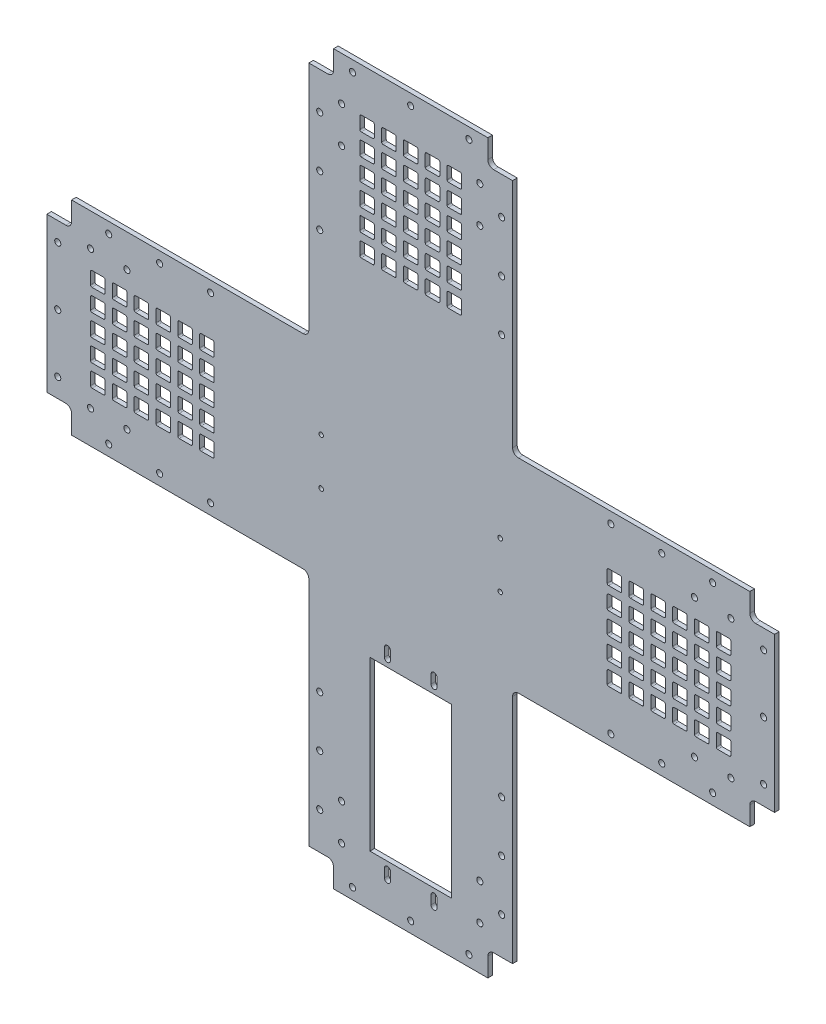
from build123d import *

# Parameters (mm, degrees)
SKETCH1_R              = 2.1
SKETCH1_W              = 56
SKETCH1_H              = 115.35
SKETCH1_R_2            = 1.55
BOSS_EXTRUDE1_DEPTH    = 3.175
FILLET1_R              = 4
SKETCH2_W              = 10
SKETCH2_H              = 10
CUT_EXTRUDE1_DEPTH     = 10
FILLET2_R              = 1
LPATTERN2_COUNT        = 5
LPATTERN2_PITCH        = 15
LPATTERN2_COUNT_DIR2   = 6
LPATTERN2_PITCH_DIR2   = 15
FILLET2_OF_LPATTERN2_R = 1
SKETCH6_W              = 10
SKETCH6_H              = 10
CUT_EXTRUDE2_DEPTH     = 10
FILLET3_R              = 1
LPATTERN5_COUNT        = 5
LPATTERN5_PITCH        = 15
LPATTERN5_COUNT_DIR2   = 6
LPATTERN5_PITCH_DIR2   = 15
FILLET3_OF_LPATTERN5_R = 1
SKETCH9_W              = 10
SKETCH9_H              = 10
CUT_EXTRUDE10_DEPTH    = 5
FILLET4_R              = 1
LPATTERN6_COUNT        = 5
LPATTERN6_PITCH        = 15
LPATTERN6_COUNT_DIR2   = 6
LPATTERN6_PITCH_DIR2   = 15
FILLET4_OF_LPATTERN6_R = 1


with BuildPart() as part:
    # Sketch1 → Boss-Extrude1 (new body)
    with BuildSketch(Plane.XY):
        Polygon((0, 163), (0, 0), (-163, 0), (-163, -17), (-180, -17), (-180, -123), (-163, -123), (-163, -140), (0, -140), (0, -303), (17, -303), (17, -320), (123, -320), (123, -303), (140, -303), (140, -140), (303, -140), (303, -123), (320, -123), (320, -17), (303, -17), (303, 0), (140, 0), (140, 163), (123, 163), (123, 180), (17, 180), (17, 163), align=None)
        with Locations((7.5, -277.5)):
            Circle(SKETCH1_R, mode=Mode.SUBTRACT)
        with Locations((30, -312.5)):
            Circle(SKETCH1_R, mode=Mode.SUBTRACT)
        with Locations((22.5, -290)):
            Circle(SKETCH1_R, mode=Mode.SUBTRACT)
        with Locations((70, -312.5)):
            Circle(SKETCH1_R, mode=Mode.SUBTRACT)
        with BuildLine():
            Line((51.95, -296), (51.95, -290))
            ThreePointArc((51.95, -290), (54, -287.95), (56.05, -290))
            Line((56.05, -290), (56.05, -296))
            ThreePointArc((56.05, -296), (54, -298.05), (51.95, -296))
        make_face(mode=Mode.SUBTRACT)
        with Locations((22.5, -265)):
            Circle(SKETCH1_R, mode=Mode.SUBTRACT)
        with Locations((7.5, -242.5)):
            Circle(SKETCH1_R, mode=Mode.SUBTRACT)
        with Locations((7.5, -207.5)):
            Circle(SKETCH1_R, mode=Mode.SUBTRACT)
        with Locations((70, -227.325)):
            Rectangle(SKETCH1_W, SKETCH1_H, mode=Mode.SUBTRACT)
        with Locations((-150, -117.5)):
            Circle(SKETCH1_R, mode=Mode.SUBTRACT)
        with Locations((-172.5, -110)):
            Circle(SKETCH1_R, mode=Mode.SUBTRACT)
        with Locations((-137.5, -132.5)):
            Circle(SKETCH1_R, mode=Mode.SUBTRACT)
        with Locations((-125, -117.5)):
            Circle(SKETCH1_R, mode=Mode.SUBTRACT)
        with Locations((-102.5, -132.5)):
            Circle(SKETCH1_R, mode=Mode.SUBTRACT)
        with Locations((-67.5, -132.5)):
            Circle(SKETCH1_R, mode=Mode.SUBTRACT)
        with BuildLine():
            ThreePointArc((56.05, -164.65), (54, -166.7), (51.95, -164.65))
            Line((51.95, -164.65), (51.95, -158.65))
            ThreePointArc((51.95, -158.65), (54, -156.6), (56.05, -158.65))
            Line((56.05, -158.65), (56.05, -164.65))
        make_face(mode=Mode.SUBTRACT)
        with Locations((8.5, -86)):
            Circle(SKETCH1_R_2, mode=Mode.SUBTRACT)
        with BuildLine():
            ThreePointArc((83.95, -290), (86, -287.95), (88.05, -290))
            Line((88.05, -290), (88.05, -296))
            ThreePointArc((88.05, -296), (86, -298.05), (83.95, -296))
            Line((83.95, -296), (83.95, -290))
        make_face(mode=Mode.SUBTRACT)
        with Locations((110, -312.5)):
            Circle(SKETCH1_R, mode=Mode.SUBTRACT)
        with Locations((117.5, -290)):
            Circle(SKETCH1_R, mode=Mode.SUBTRACT)
        with Locations((132.5, -277.5)):
            Circle(SKETCH1_R, mode=Mode.SUBTRACT)
        with Locations((117.5, -265)):
            Circle(SKETCH1_R, mode=Mode.SUBTRACT)
        with Locations((132.5, -242.5)):
            Circle(SKETCH1_R, mode=Mode.SUBTRACT)
        with Locations((132.5, -207.5)):
            Circle(SKETCH1_R, mode=Mode.SUBTRACT)
        with BuildLine():
            Line((88.05, -158.65), (88.05, -164.65))
            ThreePointArc((88.05, -164.65), (86, -166.7), (83.95, -164.65))
            Line((83.95, -164.65), (83.95, -158.65))
            ThreePointArc((83.95, -158.65), (86, -156.6), (88.05, -158.65))
        make_face(mode=Mode.SUBTRACT)
        with Locations((131.5, -86)):
            Circle(SKETCH1_R_2, mode=Mode.SUBTRACT)
        with Locations((207.5, -132.5)):
            Circle(SKETCH1_R, mode=Mode.SUBTRACT)
        with Locations((242.5, -132.5)):
            Circle(SKETCH1_R, mode=Mode.SUBTRACT)
        with Locations((277.5, -132.5)):
            Circle(SKETCH1_R, mode=Mode.SUBTRACT)
        with Locations((265, -117.5)):
            Circle(SKETCH1_R, mode=Mode.SUBTRACT)
        with Locations((290, -117.5)):
            Circle(SKETCH1_R, mode=Mode.SUBTRACT)
        with Locations((312.5, -110)):
            Circle(SKETCH1_R, mode=Mode.SUBTRACT)
        with Locations((312.5, -70)):
            Circle(SKETCH1_R, mode=Mode.SUBTRACT)
        with Locations((-172.5, -70)):
            Circle(SKETCH1_R, mode=Mode.SUBTRACT)
        with Locations((-172.5, -30)):
            Circle(SKETCH1_R, mode=Mode.SUBTRACT)
        with Locations((-150, -22.5)):
            Circle(SKETCH1_R, mode=Mode.SUBTRACT)
        with Locations((-125, -22.5)):
            Circle(SKETCH1_R, mode=Mode.SUBTRACT)
        with Locations((-137.5, -7.5)):
            Circle(SKETCH1_R, mode=Mode.SUBTRACT)
        with Locations((-102.5, -7.5)):
            Circle(SKETCH1_R, mode=Mode.SUBTRACT)
        with Locations((-67.5, -7.5)):
            Circle(SKETCH1_R, mode=Mode.SUBTRACT)
        with Locations((8.5, -54)):
            Circle(SKETCH1_R_2, mode=Mode.SUBTRACT)
        with Locations((7.5, 67.5)):
            Circle(SKETCH1_R, mode=Mode.SUBTRACT)
        with Locations((7.5, 102.5)):
            Circle(SKETCH1_R, mode=Mode.SUBTRACT)
        with Locations((7.5, 137.5)):
            Circle(SKETCH1_R, mode=Mode.SUBTRACT)
        with Locations((22.5, 125)):
            Circle(SKETCH1_R, mode=Mode.SUBTRACT)
        with Locations((22.5, 150)):
            Circle(SKETCH1_R, mode=Mode.SUBTRACT)
        with Locations((30, 172.5)):
            Circle(SKETCH1_R, mode=Mode.SUBTRACT)
        with Locations((70, 172.5)):
            Circle(SKETCH1_R, mode=Mode.SUBTRACT)
        with Locations((131.5, -54)):
            Circle(SKETCH1_R_2, mode=Mode.SUBTRACT)
        with Locations((207.5, -7.5)):
            Circle(SKETCH1_R, mode=Mode.SUBTRACT)
        with Locations((242.5, -7.5)):
            Circle(SKETCH1_R, mode=Mode.SUBTRACT)
        with Locations((265, -22.5)):
            Circle(SKETCH1_R, mode=Mode.SUBTRACT)
        with Locations((277.5, -7.5)):
            Circle(SKETCH1_R, mode=Mode.SUBTRACT)
        with Locations((312.5, -30)):
            Circle(SKETCH1_R, mode=Mode.SUBTRACT)
        with Locations((290, -22.5)):
            Circle(SKETCH1_R, mode=Mode.SUBTRACT)
        with Locations((132.5, 67.5)):
            Circle(SKETCH1_R, mode=Mode.SUBTRACT)
        with Locations((132.5, 102.5)):
            Circle(SKETCH1_R, mode=Mode.SUBTRACT)
        with Locations((117.5, 125)):
            Circle(SKETCH1_R, mode=Mode.SUBTRACT)
        with Locations((132.5, 137.5)):
            Circle(SKETCH1_R, mode=Mode.SUBTRACT)
        with Locations((117.5, 150)):
            Circle(SKETCH1_R, mode=Mode.SUBTRACT)
        with Locations((110, 172.5)):
            Circle(SKETCH1_R, mode=Mode.SUBTRACT)
    extrude(amount=BOSS_EXTRUDE1_DEPTH)

    # Fillet1
    fillet1_edges = [part.edges().sort_by_distance(p)[0] for p in [
        (17, -303, 1.5875),
        (0, -140, 1.5875),
        (-163, -123, 1.5875),
        (-163, -17, 1.5875),
        (0, 0, 1.5875),
        (17, 163, 1.5875),
        (123, 163, 1.5875),
        (140, 0, 1.5875),
        (303, -17, 1.5875),
        (303, -123, 1.5875),
        (140, -140, 1.5875),
        (123, -303, 1.5875),
    ]]
    fillet(fillet1_edges, radius=FILLET1_R)

    # Sketch2 → Cut-Extrude1 (cut)
    with BuildSketch(Plane.XY.offset(3.175)):
        with Locations((40, 145)):
            Rectangle(SKETCH2_W, SKETCH2_H)
    cut_extrude1 = extrude(amount=-CUT_EXTRUDE1_DEPTH, mode=Mode.SUBTRACT)

    # Fillet2
    fillet2_edges = [part.edges().sort_by_distance(p)[0] for p in [
        (45, 150, 1.5875),
        (45, 140, 1.5875),
        (35, 140, 1.5875),
        (35, 150, 1.5875),
    ]]
    fillet(fillet2_edges, radius=FILLET2_R)

    # LPattern2: Cut-Extrude1 5 × 6
    with Locations(*[(i * LPATTERN2_PITCH, -j * LPATTERN2_PITCH_DIR2, 0) for i in range(LPATTERN2_COUNT) for j in range(LPATTERN2_COUNT_DIR2) if (i, j) != (0, 0)]):
        add(cut_extrude1, mode=Mode.SUBTRACT)

    # Fillet2 of LPattern2
    fillet2_of_lpattern2_edges = [part.edges().sort_by_distance(p)[0] for p in [
        (45, 135, 1.5875),
        (45, 125, 1.5875),
        (35, 125, 1.5875),
        (35, 135, 1.5875),
        (45, 120, 1.5875),
        (45, 110, 1.5875),
        (35, 110, 1.5875),
        (35, 120, 1.5875),
        (45, 105, 1.5875),
        (45, 95, 1.5875),
        (35, 95, 1.5875),
        (35, 105, 1.5875),
        (45, 90, 1.5875),
        (45, 80, 1.5875),
        (35, 80, 1.5875),
        (35, 90, 1.5875),
        (45, 75, 1.5875),
        (45, 65, 1.5875),
        (35, 65, 1.5875),
        (35, 75, 1.5875),
        (60, 150, 1.5875),
        (60, 140, 1.5875),
        (50, 140, 1.5875),
        (50, 150, 1.5875),
        (60, 135, 1.5875),
        (60, 125, 1.5875),
        (50, 125, 1.5875),
        (50, 135, 1.5875),
        (60, 120, 1.5875),
        (60, 110, 1.5875),
        (50, 110, 1.5875),
        (50, 120, 1.5875),
        (60, 105, 1.5875),
        (60, 95, 1.5875),
        (50, 95, 1.5875),
        (50, 105, 1.5875),
        (60, 90, 1.5875),
        (60, 80, 1.5875),
        (50, 80, 1.5875),
        (50, 90, 1.5875),
        (60, 75, 1.5875),
        (60, 65, 1.5875),
        (50, 65, 1.5875),
        (50, 75, 1.5875),
        (75, 150, 1.5875),
        (75, 140, 1.5875),
        (65, 140, 1.5875),
        (65, 150, 1.5875),
        (75, 135, 1.5875),
        (75, 125, 1.5875),
        (65, 125, 1.5875),
        (65, 135, 1.5875),
        (75, 120, 1.5875),
        (75, 110, 1.5875),
        (65, 110, 1.5875),
        (65, 120, 1.5875),
        (75, 105, 1.5875),
        (75, 95, 1.5875),
        (65, 95, 1.5875),
        (65, 105, 1.5875),
        (75, 90, 1.5875),
        (75, 80, 1.5875),
        (65, 80, 1.5875),
        (65, 90, 1.5875),
        (75, 75, 1.5875),
        (75, 65, 1.5875),
        (65, 65, 1.5875),
        (65, 75, 1.5875),
        (90, 150, 1.5875),
        (90, 140, 1.5875),
        (80, 140, 1.5875),
        (80, 150, 1.5875),
        (90, 135, 1.5875),
        (90, 125, 1.5875),
        (80, 125, 1.5875),
        (80, 135, 1.5875),
        (90, 120, 1.5875),
        (90, 110, 1.5875),
        (80, 110, 1.5875),
        (80, 120, 1.5875),
        (90, 105, 1.5875),
        (90, 95, 1.5875),
        (80, 95, 1.5875),
        (80, 105, 1.5875),
        (90, 90, 1.5875),
        (90, 80, 1.5875),
        (80, 80, 1.5875),
        (80, 90, 1.5875),
        (90, 75, 1.5875),
        (90, 65, 1.5875),
        (80, 65, 1.5875),
        (80, 75, 1.5875),
        (105, 150, 1.5875),
        (105, 140, 1.5875),
        (95, 140, 1.5875),
        (95, 150, 1.5875),
        (105, 135, 1.5875),
        (105, 125, 1.5875),
        (95, 125, 1.5875),
        (95, 135, 1.5875),
        (105, 120, 1.5875),
        (105, 110, 1.5875),
        (95, 110, 1.5875),
        (95, 120, 1.5875),
        (105, 105, 1.5875),
        (105, 95, 1.5875),
        (95, 95, 1.5875),
        (95, 105, 1.5875),
        (105, 90, 1.5875),
        (105, 80, 1.5875),
        (95, 80, 1.5875),
        (95, 90, 1.5875),
        (105, 75, 1.5875),
        (105, 65, 1.5875),
        (95, 65, 1.5875),
        (95, 75, 1.5875),
    ]]
    fillet(fillet2_of_lpattern2_edges, radius=FILLET2_OF_LPATTERN2_R)

    # Sketch6 → Cut-Extrude2 (cut)
    with BuildSketch(Plane.XY.offset(3.175)):
        with Locations((-145, -100)):
            Rectangle(SKETCH6_W, SKETCH6_H)
    cut_extrude2 = extrude(amount=-CUT_EXTRUDE2_DEPTH, mode=Mode.SUBTRACT)

    # Fillet3
    fillet3_edges = [part.edges().sort_by_distance(p)[0] for p in [
        (-140, -95, 1.5875),
        (-140, -105, 1.5875),
        (-150, -105, 1.5875),
        (-150, -95, 1.5875),
    ]]
    fillet(fillet3_edges, radius=FILLET3_R)

    # LPattern5: Cut-Extrude2 5 × 6
    with Locations(*[(j * LPATTERN5_PITCH_DIR2, i * LPATTERN5_PITCH, 0) for i in range(LPATTERN5_COUNT) for j in range(LPATTERN5_COUNT_DIR2) if (i, j) != (0, 0)]):
        add(cut_extrude2, mode=Mode.SUBTRACT)

    # Fillet3 of LPattern5
    fillet3_of_lpattern5_edges = [part.edges().sort_by_distance(p)[0] for p in [
        (-125, -95, 1.5875),
        (-125, -105, 1.5875),
        (-135, -105, 1.5875),
        (-135, -95, 1.5875),
        (-110, -95, 1.5875),
        (-110, -105, 1.5875),
        (-120, -105, 1.5875),
        (-120, -95, 1.5875),
        (-95, -95, 1.5875),
        (-95, -105, 1.5875),
        (-105, -105, 1.5875),
        (-105, -95, 1.5875),
        (-80, -95, 1.5875),
        (-80, -105, 1.5875),
        (-90, -105, 1.5875),
        (-90, -95, 1.5875),
        (-65, -95, 1.5875),
        (-65, -105, 1.5875),
        (-75, -105, 1.5875),
        (-75, -95, 1.5875),
        (-140, -80, 1.5875),
        (-140, -90, 1.5875),
        (-150, -90, 1.5875),
        (-150, -80, 1.5875),
        (-125, -80, 1.5875),
        (-125, -90, 1.5875),
        (-135, -90, 1.5875),
        (-135, -80, 1.5875),
        (-110, -80, 1.5875),
        (-110, -90, 1.5875),
        (-120, -90, 1.5875),
        (-120, -80, 1.5875),
        (-95, -80, 1.5875),
        (-95, -90, 1.5875),
        (-105, -90, 1.5875),
        (-105, -80, 1.5875),
        (-80, -80, 1.5875),
        (-80, -90, 1.5875),
        (-90, -90, 1.5875),
        (-90, -80, 1.5875),
        (-65, -80, 1.5875),
        (-65, -90, 1.5875),
        (-75, -90, 1.5875),
        (-75, -80, 1.5875),
        (-140, -65, 1.5875),
        (-140, -75, 1.5875),
        (-150, -75, 1.5875),
        (-150, -65, 1.5875),
        (-125, -65, 1.5875),
        (-125, -75, 1.5875),
        (-135, -75, 1.5875),
        (-135, -65, 1.5875),
        (-110, -65, 1.5875),
        (-110, -75, 1.5875),
        (-120, -75, 1.5875),
        (-120, -65, 1.5875),
        (-95, -65, 1.5875),
        (-95, -75, 1.5875),
        (-105, -75, 1.5875),
        (-105, -65, 1.5875),
        (-80, -65, 1.5875),
        (-80, -75, 1.5875),
        (-90, -75, 1.5875),
        (-90, -65, 1.5875),
        (-65, -65, 1.5875),
        (-65, -75, 1.5875),
        (-75, -75, 1.5875),
        (-75, -65, 1.5875),
        (-140, -50, 1.5875),
        (-140, -60, 1.5875),
        (-150, -60, 1.5875),
        (-150, -50, 1.5875),
        (-125, -50, 1.5875),
        (-125, -60, 1.5875),
        (-135, -60, 1.5875),
        (-135, -50, 1.5875),
        (-110, -50, 1.5875),
        (-110, -60, 1.5875),
        (-120, -60, 1.5875),
        (-120, -50, 1.5875),
        (-95, -50, 1.5875),
        (-95, -60, 1.5875),
        (-105, -60, 1.5875),
        (-105, -50, 1.5875),
        (-80, -50, 1.5875),
        (-80, -60, 1.5875),
        (-90, -60, 1.5875),
        (-90, -50, 1.5875),
        (-65, -50, 1.5875),
        (-65, -60, 1.5875),
        (-75, -60, 1.5875),
        (-75, -50, 1.5875),
        (-140, -35, 1.5875),
        (-140, -45, 1.5875),
        (-150, -45, 1.5875),
        (-150, -35, 1.5875),
        (-125, -35, 1.5875),
        (-125, -45, 1.5875),
        (-135, -45, 1.5875),
        (-135, -35, 1.5875),
        (-110, -35, 1.5875),
        (-110, -45, 1.5875),
        (-120, -45, 1.5875),
        (-120, -35, 1.5875),
        (-95, -35, 1.5875),
        (-95, -45, 1.5875),
        (-105, -45, 1.5875),
        (-105, -35, 1.5875),
        (-80, -35, 1.5875),
        (-80, -45, 1.5875),
        (-90, -45, 1.5875),
        (-90, -35, 1.5875),
        (-65, -35, 1.5875),
        (-65, -45, 1.5875),
        (-75, -45, 1.5875),
        (-75, -35, 1.5875),
    ]]
    fillet(fillet3_of_lpattern5_edges, radius=FILLET3_OF_LPATTERN5_R)

    # Sketch9 → Cut-Extrude10 (cut)
    with BuildSketch(Plane.XY.offset(3.175)):
        with Locations((285, -100)):
            Rectangle(SKETCH9_W, SKETCH9_H)
    cut_extrude10 = extrude(amount=-CUT_EXTRUDE10_DEPTH, mode=Mode.SUBTRACT)

    # Fillet4
    fillet4_edges = [part.edges().sort_by_distance(p)[0] for p in [
        (290, -95, 1.5875),
        (290, -105, 1.5875),
        (280, -105, 1.5875),
        (280, -95, 1.5875),
    ]]
    fillet(fillet4_edges, radius=FILLET4_R)

    # LPattern6: Cut-Extrude10 5 × 6
    with Locations(*[(-j * LPATTERN6_PITCH_DIR2, i * LPATTERN6_PITCH, 0) for i in range(LPATTERN6_COUNT) for j in range(LPATTERN6_COUNT_DIR2) if (i, j) != (0, 0)]):
        add(cut_extrude10, mode=Mode.SUBTRACT)

    # Fillet4 of LPattern6
    fillet4_of_lpattern6_edges = [part.edges().sort_by_distance(p)[0] for p in [
        (275, -95, 1.5875),
        (275, -105, 1.5875),
        (265, -105, 1.5875),
        (265, -95, 1.5875),
        (260, -95, 1.5875),
        (260, -105, 1.5875),
        (250, -105, 1.5875),
        (250, -95, 1.5875),
        (245, -95, 1.5875),
        (245, -105, 1.5875),
        (235, -105, 1.5875),
        (235, -95, 1.5875),
        (230, -95, 1.5875),
        (230, -105, 1.5875),
        (220, -105, 1.5875),
        (220, -95, 1.5875),
        (215, -95, 1.5875),
        (215, -105, 1.5875),
        (205, -105, 1.5875),
        (205, -95, 1.5875),
        (290, -80, 1.5875),
        (290, -90, 1.5875),
        (280, -90, 1.5875),
        (280, -80, 1.5875),
        (275, -80, 1.5875),
        (275, -90, 1.5875),
        (265, -90, 1.5875),
        (265, -80, 1.5875),
        (260, -80, 1.5875),
        (260, -90, 1.5875),
        (250, -90, 1.5875),
        (250, -80, 1.5875),
        (245, -80, 1.5875),
        (245, -90, 1.5875),
        (235, -90, 1.5875),
        (235, -80, 1.5875),
        (230, -80, 1.5875),
        (230, -90, 1.5875),
        (220, -90, 1.5875),
        (220, -80, 1.5875),
        (215, -80, 1.5875),
        (215, -90, 1.5875),
        (205, -90, 1.5875),
        (205, -80, 1.5875),
        (290, -65, 1.5875),
        (290, -75, 1.5875),
        (280, -75, 1.5875),
        (280, -65, 1.5875),
        (275, -65, 1.5875),
        (275, -75, 1.5875),
        (265, -75, 1.5875),
        (265, -65, 1.5875),
        (260, -65, 1.5875),
        (260, -75, 1.5875),
        (250, -75, 1.5875),
        (250, -65, 1.5875),
        (245, -65, 1.5875),
        (245, -75, 1.5875),
        (235, -75, 1.5875),
        (235, -65, 1.5875),
        (230, -65, 1.5875),
        (230, -75, 1.5875),
        (220, -75, 1.5875),
        (220, -65, 1.5875),
        (215, -65, 1.5875),
        (215, -75, 1.5875),
        (205, -75, 1.5875),
        (205, -65, 1.5875),
        (290, -50, 1.5875),
        (290, -60, 1.5875),
        (280, -60, 1.5875),
        (280, -50, 1.5875),
        (275, -50, 1.5875),
        (275, -60, 1.5875),
        (265, -60, 1.5875),
        (265, -50, 1.5875),
        (260, -50, 1.5875),
        (260, -60, 1.5875),
        (250, -60, 1.5875),
        (250, -50, 1.5875),
        (245, -50, 1.5875),
        (245, -60, 1.5875),
        (235, -60, 1.5875),
        (235, -50, 1.5875),
        (230, -50, 1.5875),
        (230, -60, 1.5875),
        (220, -60, 1.5875),
        (220, -50, 1.5875),
        (215, -50, 1.5875),
        (215, -60, 1.5875),
        (205, -60, 1.5875),
        (205, -50, 1.5875),
        (290, -35, 1.5875),
        (290, -45, 1.5875),
        (280, -45, 1.5875),
        (280, -35, 1.5875),
        (275, -35, 1.5875),
        (275, -45, 1.5875),
        (265, -45, 1.5875),
        (265, -35, 1.5875),
        (260, -35, 1.5875),
        (260, -45, 1.5875),
        (250, -45, 1.5875),
        (250, -35, 1.5875),
        (245, -35, 1.5875),
        (245, -45, 1.5875),
        (235, -45, 1.5875),
        (235, -35, 1.5875),
        (230, -35, 1.5875),
        (230, -45, 1.5875),
        (220, -45, 1.5875),
        (220, -35, 1.5875),
        (215, -35, 1.5875),
        (215, -45, 1.5875),
        (205, -45, 1.5875),
        (205, -35, 1.5875),
    ]]
    fillet(fillet4_of_lpattern6_edges, radius=FILLET4_OF_LPATTERN6_R)


solid = part.part
